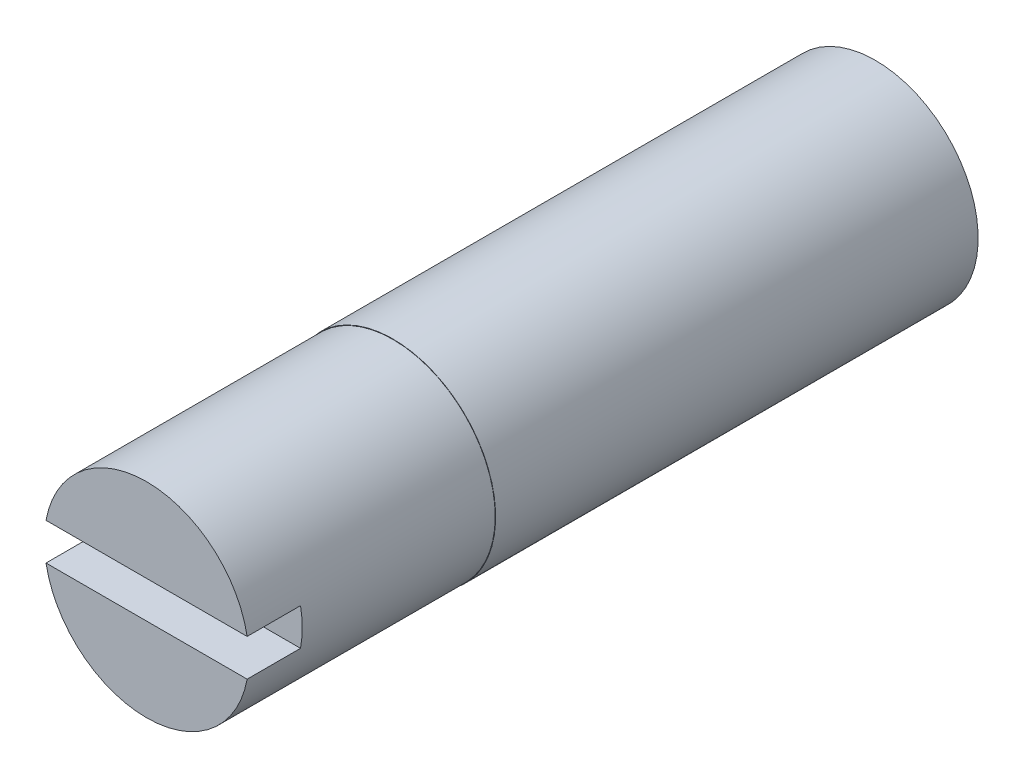
from build123d import *

# Parameters (mm, degrees)
SKETCH_1_R          = 2.49
EXTRUDE_1_DEPTH     = 6
SKETCH_8_W          = 5
SKETCH_8_H          = 0.9
CUT_EXTRUDE_2_DEPTH = 1.3
SKETCH_9_R          = 2.5
EXTRUDE_2_DEPTH     = 11.75


with BuildPart() as part:
    # 草圖1 → 填料-伸長1 (new body)
    with BuildSketch(Plane.XY):
        Circle(SKETCH_1_R)
    extrude(amount=EXTRUDE_1_DEPTH)

    # 草圖8 → 除料-伸長2 (cut)
    with BuildSketch(Plane.XY.offset(6)):
        Rectangle(SKETCH_8_W, SKETCH_8_H)
    extrude(amount=-CUT_EXTRUDE_2_DEPTH, mode=Mode.SUBTRACT)

    # 草圖9 → 填料-伸長2 (add)
    with BuildSketch(Plane(origin=(0, 0, 0), x_dir=(-1, 0, 0), z_dir=(0, 0, -1))):
        Circle(SKETCH_9_R)
    extrude(amount=EXTRUDE_2_DEPTH)


solid = part.part
